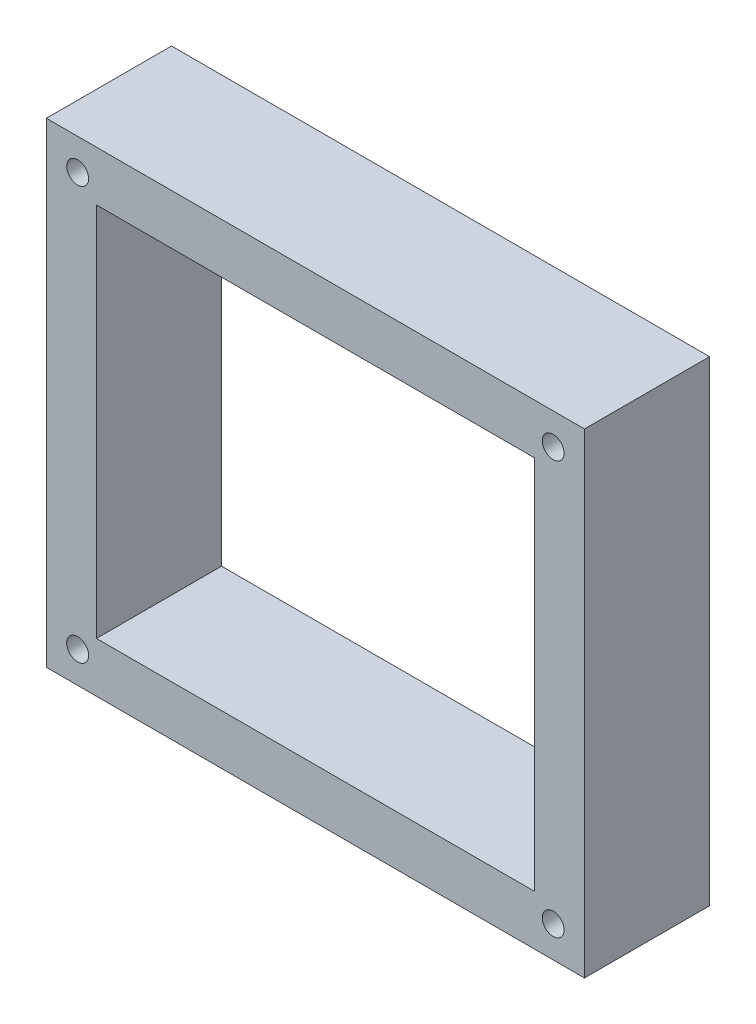
from build123d import *

# Parameters (mm, degrees)
SKETCH_1_W      = 86
SKETCH_1_H      = 76
SKETCH_1_R      = 1.75
SKETCH_1_W_2    = 70
SKETCH_1_H_2    = 60
EXTRUDE_1_DEPTH = 20


with BuildPart() as part:
    # 草图1 → 凸台-拉伸1 (new body)
    with BuildSketch(Plane.XY):
        Rectangle(SKETCH_1_W, SKETCH_1_H)
        with Locations((-38, -33)):
            Circle(SKETCH_1_R, mode=Mode.SUBTRACT)
        with Locations((38, -33)):
            Circle(SKETCH_1_R, mode=Mode.SUBTRACT)
        with Locations((-38, 33)):
            Circle(SKETCH_1_R, mode=Mode.SUBTRACT)
        Rectangle(SKETCH_1_W_2, SKETCH_1_H_2, mode=Mode.SUBTRACT)
        with Locations((38, 33)):
            Circle(SKETCH_1_R, mode=Mode.SUBTRACT)
    extrude(amount=EXTRUDE_1_DEPTH)


solid = part.part
